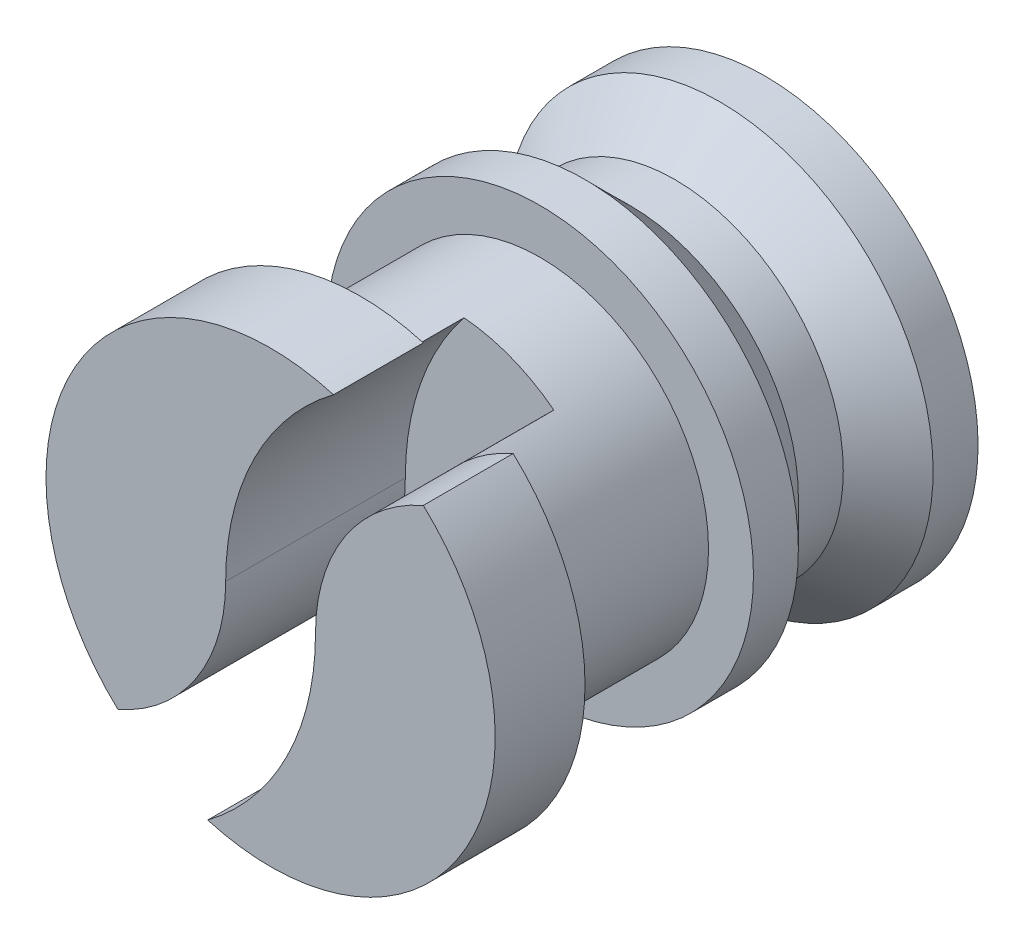
from build123d import *

# Parameters (mm, degrees)
EXTRUDE_1_DEPTH      = 14
EXTRUDE_1_DEPTH_BACK = 2
SKETCH_1_R           = 7.5
EXTRUDE_START        = 2
SKETCH_2_R           = 9.5
EXTRUDE_2_DEPTH      = 2
EXTRUDE_START_2      = 12
SKETCH_5_R           = 10
EXTRUDE_3_DEPTH      = 4
CUT_EXTRUDE_START    = 8
CUT_EXTRUDE_3_DEPTH  = 8
SKETCH_10_R          = 6.5
CUT_EXTRUDE_4_DEPTH  = 3
SKETCH_11_W          = 10
SKETCH_11_H          = 5
CUT_EXTRUDE_5_DEPTH  = 5
EXTRUDE_6_DEPTH      = 1.5
EXTRUDE_6_DEPTH_BACK = 1.5


with BuildPart() as part:
    # Эскиз1 → Бобышка-Вытянуть1 (new, two sides: drawn at the far end of the back side and taken through both)
    with BuildSketch(Plane.XY.offset(-EXTRUDE_1_DEPTH_BACK)):
        Circle(SKETCH_1_R)
    extrude(amount=EXTRUDE_1_DEPTH + EXTRUDE_1_DEPTH_BACK)

    # Эскиз2 → Бобышка-Вытянуть2 (add)
    with BuildSketch(Plane.XY.offset(EXTRUDE_START)):
        Circle(SKETCH_2_R)
    extrude(amount=EXTRUDE_2_DEPTH)

    # Эскиз5 → Бобышка-Вытянуть3 (add)
    with BuildSketch(Plane.XY.offset(EXTRUDE_START_2)):
        Circle(SKETCH_5_R)
    extrude(amount=EXTRUDE_3_DEPTH)

    # Эскиз9 → Вырез-Вытянуть3 (cut)
    with BuildSketch(Plane.XY.offset(CUT_EXTRUDE_START)):
        with BuildLine():
            ThreePointArc((2, 0), (5.550280908, 6.648308055), (13.05, 7.395775821))
            ThreePointArc((13.05, 7.395775821), (11.283433415, 9.883528235), (9.05, 11.962336728))
            ThreePointArc((9.05, 11.962336728), (1.185239652, 8.142481194), (-2, 0))
            ThreePointArc((-2, 0), (-5.550280908, -6.648308055), (-13.05, -7.395775821))
            ThreePointArc((-13.05, -7.395775821), (-11.283433415, -9.883528235), (-9.05, -11.962336728))
            ThreePointArc((-9.05, -11.962336728), (-1.185239652, -8.142481194), (2, 0))
        make_face()
    extrude(amount=CUT_EXTRUDE_3_DEPTH, mode=Mode.SUBTRACT)

    # Эскиз10 → Вырез-Вытянуть4 (cut)
    with BuildSketch(Plane.XY):
        Circle(SKETCH_10_R)
    extrude(amount=CUT_EXTRUDE_4_DEPTH, mode=Mode.SUBTRACT)

    # Эскиз11 → Вырез-Вытянуть5 (cut)
    with BuildSketch(Plane.XY):
        Rectangle(SKETCH_11_W, SKETCH_11_H)
    extrude(amount=CUT_EXTRUDE_5_DEPTH, mode=Mode.SUBTRACT)

    # Эскиз12 → Повернуть1 (revolve)
    with BuildSketch(Plane(origin=(0, 0, 0), x_dir=(0, 0, -1), z_dir=(1, 0, 0))):
        Polygon((-2, 9.5), (0, 7.5), (-2, 7.5), align=None)
    revolve(axis=Axis((0, 0, 0), (0, 0, 1)))

    # Эскиз13 → Повернуть2 (revolve)
    with BuildSketch(Plane(origin=(0, 0, 0), x_dir=(0, 0, -1), z_dir=(1, 0, 0))):
        Polygon((2, 7.5), (4, 9.5), (6, 9.5), (6, 7.5), (4, 7.5), (2, 5.5), align=None)
    revolve(axis=Axis((0, 0, 0), (0, 0, 1)))

    # Эскиз16 → Бобышка-Вытянуть6 (add, two sides: drawn at the far end of the back side and taken through both)
    with BuildSketch(Plane(origin=(0, 0, 0), x_dir=(0, 0, -1), z_dir=(1, 0, 0)).offset(-EXTRUDE_6_DEPTH_BACK)):
        Polygon((6, 7.5), (4, 7.5), (2, 5.5), (2, -5.5), (4, -7.5), (6, -7.5), align=None)
    extrude(amount=EXTRUDE_6_DEPTH + EXTRUDE_6_DEPTH_BACK)


solid = part.part
